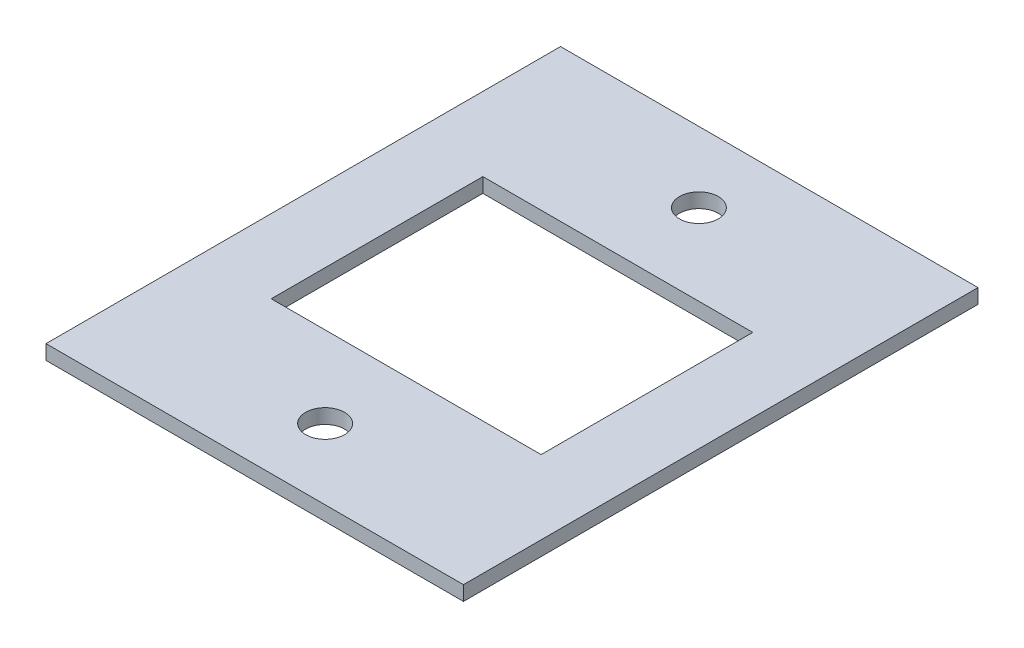
from build123d import *

# Parameters (mm, degrees)
SKETCH_1_W      = 43
SKETCH_1_H      = 53
SKETCH_1_R      = 2
SKETCH_1_W_2    = 27.8
SKETCH_1_H_2    = 21.8
EXTRUDE_1_DEPTH = 1.5


with BuildPart() as part:
    # Эскиз1 → Бобышка-Вытянуть1 (new body)
    with BuildSketch(Plane(origin=(0, 0, 0), x_dir=(1, 0, 0), z_dir=(0, 1, 0))):
        with Locations((21.5, 26.5)):
            Rectangle(SKETCH_1_W, SKETCH_1_H)
        with Locations((21.5, 7.25)):
            Circle(SKETCH_1_R, mode=Mode.SUBTRACT)
        with Locations((21.5, 45.75)):
            Circle(SKETCH_1_R, mode=Mode.SUBTRACT)
        with Locations((21.5, 26.5)):
            Rectangle(SKETCH_1_W_2, SKETCH_1_H_2, mode=Mode.SUBTRACT)
    extrude(amount=EXTRUDE_1_DEPTH)


solid = part.part
